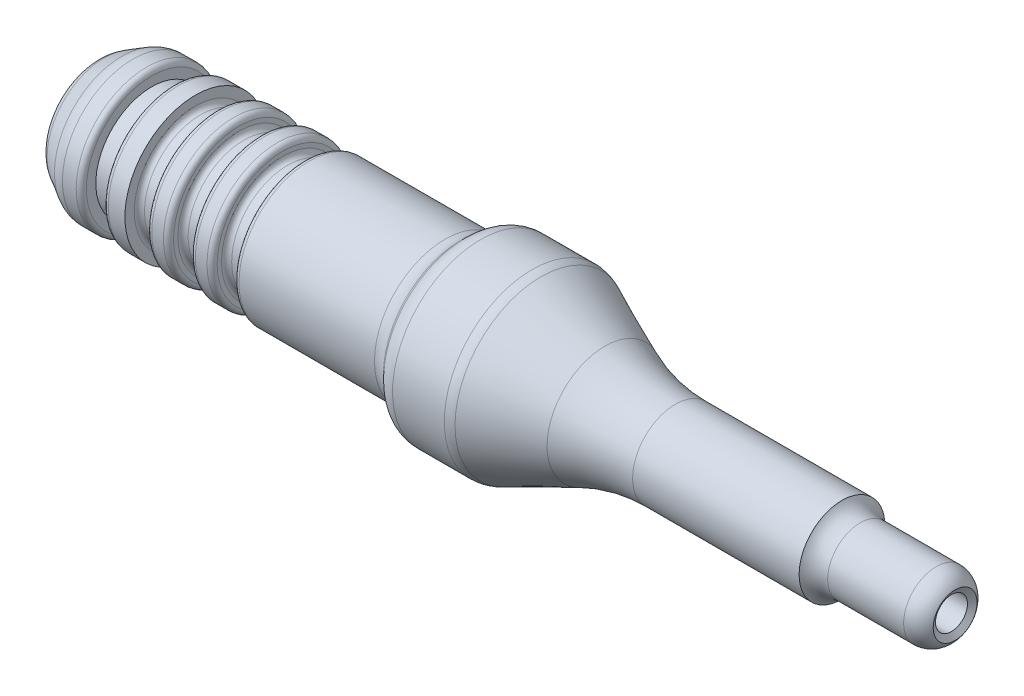
from build123d import *

# Parameters (mm, degrees)
SKETCH2_W     = 1.4999999999999982
SKETCH2_H     = 1.0000000000000004
FILLET1_R     = 12
FILLET2_R     = 1.5
CHAMFER2_SIZE = 0.414686489
FILLET3_R     = 0.35


with BuildPart() as part:
    # Sketch1 → Revolve1 (revolve)
    with BuildSketch(Plane.XY, mode=Mode.PRIVATE) as revolve1_sk:
        Polygon((0, 0), (0, 3.5200000000000022), (2.2999999999999994, 4.847905619136144), (24.8, 4.847905619136145), (26, 6.0479056191361495), (30.5, 6.0479056191361495), (37.50000000000001, 2.9473941251088354), (51.49999999999999, 2.947394125108837), (51.90264068586283, 2.2500000000000004), (59.452640685862825, 2.25), (59.452640685862825, 0), align=None)
    revolve(revolve1_sk.sketch.rotate(Axis((0, 0, 0), (1, 0, 0)), 90), axis=Axis((0, 0, 0), (1, 0, 0)))

    # Sketch2 → Cut-Revolve1 (revolve, cut)
    with BuildSketch(Plane.XY, mode=Mode.PRIVATE) as cut_revolve1_sk:
        Polygon((0, 0), (0, 2.2499999999999987), (33.5, 2.2500000000000004), (35.491858428704205, 1.1), (59.45264068586281, 1.1000000000000003), (59.45264068586281, 0), align=None)
        Polygon((3.9999999999999964, 4.847905619136145), (5.5, 4.847905619136145), (5.500000000000002, 3.8479056191361445), (3.999999999999999, 3.8479056191361454), align=None)
        Polygon((7.000000000000003, 4.847905619136145), (8.5, 4.847905619136145), (8.500000000000004, 3.8479056191361445), (7.000000000000003, 3.8479056191361445), align=None)
        with Locations((10.750000000000004, 4.347905619136145)):
            Rectangle(SKETCH2_W, SKETCH2_H)
        Polygon((13.00000000000001, 4.847905619136145), (14.500000000000005, 4.847905619136145), (14.500000000000012, 3.8479056191361445), (13.000000000000005, 3.8479056191361445), align=None)
    revolve(cut_revolve1_sk.sketch.rotate(Axis((59.45264068586281, 0, 0), (-1, 0, 0)), 90), axis=Axis((59.45264068586281, 0, 0), (-1, 0, 0)), mode=Mode.SUBTRACT)

    # Fillet1
    fillet1_edges = [part.edges().sort_by_distance(p)[0] for p in [
        (37.50000000000001, 6.2e-16, -2.9473941251088354),
    ]]
    fillet(fillet1_edges, radius=FILLET1_R)

    # Fillet2
    # the kernel refuses this fillet: 1.5 mm, written as the material it adds along each edge
    with BuildSketch(Plane(origin=(24.8, 0, 0), x_dir=(0, 1.1e-16, 1), z_dir=(0, 1, -1.1e-16))) as fillet2_piece_1:
        with BuildLine():
            CenterArc((4.847905619136145 + FILLET2_R, -FILLET2_R * 0.414213562373), FILLET2_R, 134.9999999999999, 45.00000000000023)
            Line((4.847905619136146, -FILLET2_R * 0.414213562373), (4.847905619136145 - FILLET2_R * 0.02, -FILLET2_R * 0.414213562373))
            Line((4.847905619136145 - FILLET2_R * 0.02, -FILLET2_R * 0.414213562373), (4.847905619136145 - FILLET2_R * 0.02, FILLET2_R * 0.00828427124746))
            Line((4.847905619136145 - FILLET2_R * 0.02, FILLET2_R * 0.00828427124746), (4.847905619136145 + FILLET2_R * 0.27875108319, FILLET2_R * 0.307035354437))
            Line((4.847905619136145 + FILLET2_R * 0.27875108319, FILLET2_R * 0.307035354437), (4.847905619136145 + FILLET2_R * 0.292893218813, FILLET2_R * 0.292893218813))
        make_face()
    revolve(axis=Axis((24.8, 0, 0), (1, 0, 0)))
    with BuildSketch(Plane(origin=(51.90264068586283, 0, 0), x_dir=(0, 1.1e-16, 1), z_dir=(0, 1, -1.1e-16))) as fillet2_piece_2:
        with BuildLine():
            CenterArc((3.7500000000000004, 0.8645703500700961), FILLET2_R, 180, 57.651301677751064)
            Line((2.2500000000000004, 0.8645703500700961), (2.2200000000000006, 0.8645703500700961))
            Line((2.2200000000000006, 0.8645703500700961), (2.2200000000000006, 0))
            Line((2.2200000000000006, 0), (2.2350000000000008, -0.02598076211353373))
            ThreePointArc((2.2350000000000008, -0.02598076211353373), (2.5836970625544207, -0.22730110504495116), (2.931342007611018, -0.4279849065814858))
            Line((2.931342007611018, -0.4279849065814858), (2.947394125108841, -0.40264068586282775))
        make_face()
    revolve(axis=Axis((51.90264068586283, 0, 0), (1, 0, 0)))
    # the kernel refuses this fillet: 1.5 mm, written as the material it takes off along each edge
    with BuildSketch(Plane(origin=(30.5, 0, 0), x_dir=(0, 1.1e-16, 1), z_dir=(0, 1, -1.1e-16))) as fillet2_2_piece_1:
        with BuildLine():
            CenterArc((6.0479056191361495 - FILLET2_R, -FILLET2_R * 0.211553464978), FILLET2_R, 0, 23.889999999999986)
            Line((6.0479056191361495, -FILLET2_R * 0.211553464978), (6.0479056191361495 + FILLET2_R * 0.02, -FILLET2_R * 0.211553464978))
            Line((6.0479056191361495 + FILLET2_R * 0.02, -FILLET2_R * 0.211553464978), (6.0479056191361495 + FILLET2_R * 0.02, FILLET2_R * 0.00423106929956))
            Line((6.0479056191361495 + FILLET2_R * 0.02, FILLET2_R * 0.00423106929956), (6.0479056191361495 - FILLET2_R * 0.0673888551076, FILLET2_R * 0.201528188479))
            Line((6.0479056191361495 - FILLET2_R * 0.0673888551076, FILLET2_R * 0.201528188479), (6.0479056191361495 - FILLET2_R * 0.0856753481447, FILLET2_R * 0.193428548215))
        make_face()
    revolve(axis=Axis((30.5, 0, 0), (1, 0, 0)), mode=Mode.SUBTRACT)
    with BuildSketch(Plane(origin=(26, 0, 0), x_dir=(0, 1.1e-16, 1), z_dir=(0, 1, -1.1e-16))) as fillet2_2_piece_2:
        with BuildLine():
            CenterArc((6.0479056191361495 - FILLET2_R, FILLET2_R * 0.414213562373), FILLET2_R, 314.9999999999998, 45.00000000000023)
            Line((6.0479056191361495 - FILLET2_R * 0.292893218813, -FILLET2_R * 0.292893218813), (6.0479056191361495 - FILLET2_R * 0.27875108319, -FILLET2_R * 0.307035354437))
            Line((6.0479056191361495 - FILLET2_R * 0.27875108319, -FILLET2_R * 0.307035354437), (6.0479056191361495 + FILLET2_R * 0.02, -FILLET2_R * 0.00828427124746))
            Line((6.0479056191361495 + FILLET2_R * 0.02, -FILLET2_R * 0.00828427124746), (6.0479056191361495 + FILLET2_R * 0.02, FILLET2_R * 0.414213562373))
            Line((6.0479056191361495 + FILLET2_R * 0.02, FILLET2_R * 0.414213562373), (6.0479056191361495, FILLET2_R * 0.414213562373))
        make_face()
    revolve(axis=Axis((26, 0, 0), (1, 0, 0)), mode=Mode.SUBTRACT)
    with BuildSketch(Plane(origin=(2.2999999999999994, 0, 0), x_dir=(0, 1.1e-16, 1), z_dir=(0, 1, -1.1e-16))) as fillet2_2_piece_3:
        with BuildLine():
            CenterArc((4.847905619136144 - FILLET2_R, FILLET2_R * 0.267949192431), FILLET2_R, 329.99999999999994, 30.000000000000068)
            Line((4.847905619136144, FILLET2_R * 0.267949192431), (4.847905619136144 + FILLET2_R * 0.02, FILLET2_R * 0.267949192431))
            Line((4.847905619136144 + FILLET2_R * 0.02, FILLET2_R * 0.267949192431), (4.847905619136144 + FILLET2_R * 0.02, -FILLET2_R * 0.00535898384862))
            Line((4.847905619136144 + FILLET2_R * 0.02, -FILLET2_R * 0.00535898384862), (4.847905619136144 - FILLET2_R * 0.11665408814, -FILLET2_R * 0.242050807569))
            Line((4.847905619136144 - FILLET2_R * 0.11665408814, -FILLET2_R * 0.242050807569), (4.847905619136144 - FILLET2_R * 0.133974596216, -FILLET2_R * 0.232050807569))
        make_face()
    revolve(axis=Axis((2.2999999999999994, 0, 0), (1, 0, 0)), mode=Mode.SUBTRACT)
    with BuildSketch(Plane(origin=(0, 0, 0), x_dir=(0, 1.1e-16, 1), z_dir=(0, 1, -1.1e-16))) as fillet2_2_piece_4:
        with BuildLine():
            CenterArc((3.5200000000000022 - FILLET2_R * 0.57735026919, FILLET2_R), FILLET2_R, 270, 59.99999999999994)
            Line((3.5200000000000022 + FILLET2_R * 0.288675134595, FILLET2_R * 0.5), (3.5200000000000022 + FILLET2_R * 0.305995642671, FILLET2_R * 0.49))
            Line((3.5200000000000022 + FILLET2_R * 0.305995642671, FILLET2_R * 0.49), (3.5200000000000022 + FILLET2_R * 0.0115470053838, -FILLET2_R * 0.02))
            Line((3.5200000000000022 + FILLET2_R * 0.0115470053838, -FILLET2_R * 0.02), (3.5200000000000022 - FILLET2_R * 0.57735026919, -FILLET2_R * 0.02))
            Line((3.5200000000000022 - FILLET2_R * 0.57735026919, -FILLET2_R * 0.02), (3.5200000000000022 - FILLET2_R * 0.57735026919, 0))
        make_face()
    revolve(axis=Axis((0, 0, 0), (1, 0, 0)), mode=Mode.SUBTRACT)
    with BuildSketch(Plane(origin=(59.452640685862825, 0, 0), x_dir=(0, 1.1e-16, 1), z_dir=(0, 1, -1.1e-16))) as fillet2_2_piece_5:
        with BuildLine():
            CenterArc((0.7500000000000004, -1.4585952145815), FILLET2_R, 0, 76.50660117844832)
            Line((1.0999999999999994, -2.132e-14), (1.1069999999999993, 0.02917190429160854))
            ThreePointArc((1.1069999999999993, 0.02917190429160854), (1.6749999999999998, 0.03000000000000114), (2.25, 0.03000000000000114))
            Line((2.25, 0.03000000000000114), (2.28, 0))
            Line((2.28, 0), (2.2800000000000002, -1.4585952145815))
            Line((2.2800000000000002, -1.4585952145815), (2.2500000000000004, -1.4585952145815))
        make_face()
    revolve(axis=Axis((59.452640685862825, 0, 0), (1, 0, 0)), mode=Mode.SUBTRACT)

    # Chamfer1: read off the stored shape, not the designer's step
    # Chamfer1 outline → Chamfer1 (revolve, cut)
    with BuildSketch(Plane.YX):
        Polygon((2.25, 0.504621116), (2.25, 0), (2.798012702, 0), (2.798012702, 0.006931675), align=None)
    revolve(axis=Axis((0, 0, 0), (1, 0, 0)), mode=Mode.SUBTRACT)

    # Chamfer2
    # the kernel refuses this chamfer: 0.5, 0.414686489 mm, written as the material it takes off along each edge
    with BuildSketch(Plane(origin=(59.45264068586281, 0, 0), x_dir=(0, 1.1e-16, -1), z_dir=(0, 1, 1.1e-16))) as chamfer2_piece_1:
        with BuildLine():
            Line((1.5083255358605607, 0.16439956412381918), (1.1, CHAMFER2_SIZE))
            Line((1.1, CHAMFER2_SIZE), (1.1000000000000003, 0))
            ThreePointArc((1.1000000000000003, 0), (1.3157778356018057, 0.06938844784601628), (1.5083255358605607, 0.16439956412381918))
        make_face()
    revolve(axis=Axis((59.45264068586281, 0, 0), (-1, 0, 0)), revolution_arc=180, mode=Mode.SUBTRACT)
    with BuildSketch(Plane(origin=(59.45264068586281, 0, 0), x_dir=(0, -2.3e-16, 1), z_dir=(0, -1, -2.3e-16))) as chamfer2_piece_2:
        with BuildLine():
            Line((1.5083255358605607, 0.16439956412381918), (1.1, CHAMFER2_SIZE))
            Line((1.1, CHAMFER2_SIZE), (1.1000000000000003, 0))
            ThreePointArc((1.1000000000000003, 0), (1.3157778356018057, 0.06938844784601628), (1.5083255358605607, 0.16439956412381918))
        make_face()
    revolve(axis=Axis((59.45264068586281, 0, 0), (-1, 0, 0)), revolution_arc=180, mode=Mode.SUBTRACT)

    # Fillet3
    fillet3_edges = [part.edges().sort_by_distance(p)[0] for p in [
        (13.000000000000007, -9e-16, 3.8479056191361445),
        (14.500000000000014, -9e-16, 3.8479056191361445),
        (14.500000000000007, 9e-17, -4.847905619136146),
        (13.000000000000007, 8.4e-16, -4.847905619136146),
        (10.000000000000007, -9e-16, 3.8479056191361445),
        (11.500000000000007, 8.4e-16, -4.847905619136146),
        (10.000000000000007, 8.4e-16, -4.847905619136146),
        (7, -9e-16, 3.8479056191361445),
        (8.500000000000007, -9e-16, 3.8479056191361445),
        (8.5, 8.4e-16, -4.847905619136146),
        (5.5, -9e-16, 3.8479056191361445),
        (5.5, 8.4e-16, -4.847905619136146),
        (3.999999999999993, 8.4e-16, -4.847905619136146),
    ]]
    fillet(fillet3_edges, radius=FILLET3_R)


solid = part.part
